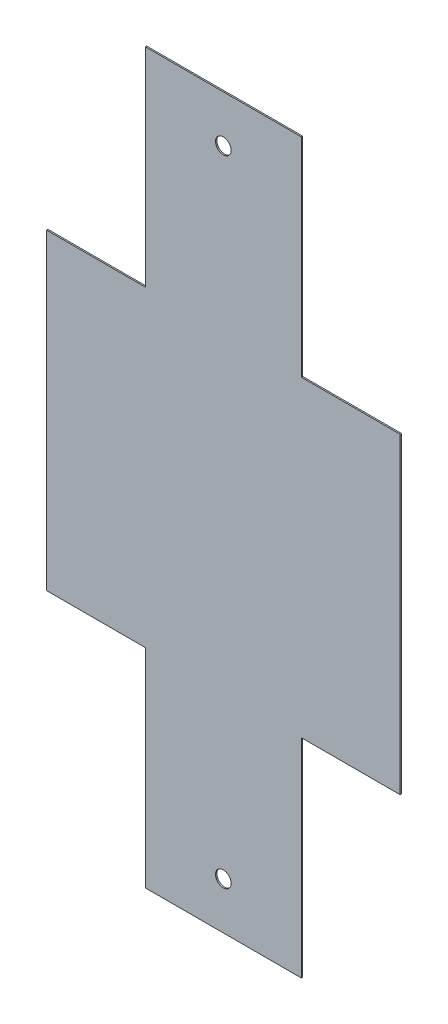
from build123d import *

# Parameters (mm, degrees)
SKETCH_1_W          = 76
SKETCH_1_H          = 70
EXTRUDE_1_DEPTH     = 0.13
CUT_EXTRUDE_1_DEPTH = 52.662528974
CUT_EXTRUDE_2_REACH = 40.91
SKETCH_3_R          = 0.75


with BuildPart() as part:
    # 草圖1 → 填料-伸長1 (new body)
    with BuildSketch(Plane.XY):
        Rectangle(SKETCH_1_W, SKETCH_1_H)
    extrude(amount=EXTRUDE_1_DEPTH)

    # 草圖2 → 除料-伸長1 (cut, through all)
    with BuildSketch(Plane.XY.offset(0.13)):
        Polygon((-38, 35), (-7.5, 35), (-7.5, 15), (-17, 15), (-17, -15), (-7.5, -15), (-7.5, -35), (-38, -35), align=None)
        Polygon((17, 15), (7.5, 15), (7.5, 35), (38, 35), (38, -35), (7.5, -35), (7.5, -15), (17, -15), align=None)
    extrude(amount=-CUT_EXTRUDE_1_DEPTH, mode=Mode.SUBTRACT)

    # 草圖3 → 除料-伸長2 (cut, up to next)
    with BuildSketch(Plane.XY.offset(0.13), mode=Mode.PRIVATE) as cut_extrude_2_sk1:
        with Locations((0, 30.5)):
            Circle(SKETCH_3_R)
    cut_extrude_2_tool1 = extrude(cut_extrude_2_sk1.sketch, amount=-CUT_EXTRUDE_2_REACH, mode=Mode.PRIVATE) & part.part
    # 草圖3 → 除料-伸長2 (cut, up to next)
    with BuildSketch(Plane.XY.offset(0.13), mode=Mode.PRIVATE) as cut_extrude_2_sk2:
        with Locations((0, -30.5)):
            Circle(SKETCH_3_R)
    cut_extrude_2_tool2 = extrude(cut_extrude_2_sk2.sketch, amount=-CUT_EXTRUDE_2_REACH, mode=Mode.PRIVATE) & part.part
    add(cut_extrude_2_tool1.solids().sort_by_distance((0, 30.5, 0.13))[0], mode=Mode.SUBTRACT)
    add(cut_extrude_2_tool2.solids().sort_by_distance((0, -30.5, 0.13))[0], mode=Mode.SUBTRACT)


solid = part.part
